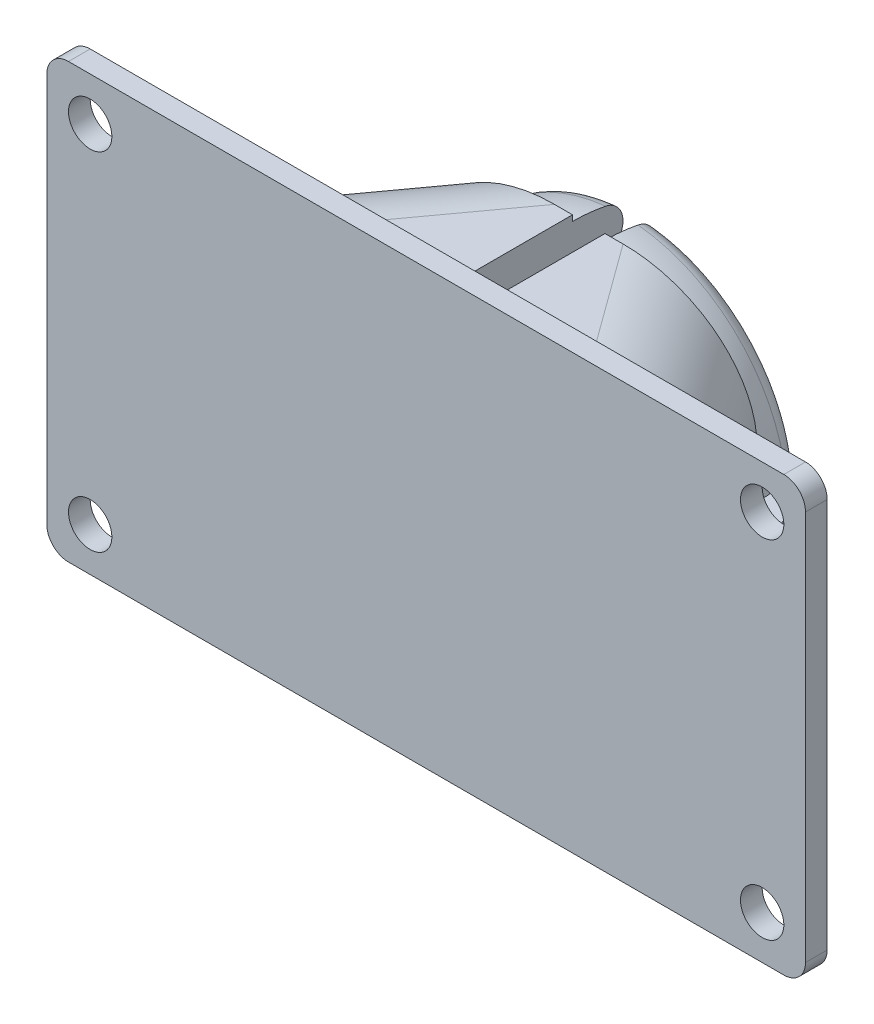
from build123d import *

# Parameters (mm, degrees)
ESQUISSE1_W                     = 70
ESQUISSE1_H                     = 40
BOSS_EXTRU_1_DEPTH              = 2
BOSS_EXTRU_2_DEPTH              = 16
CONG_1_R                        = 10
ENL_V_MAT_EXTRU_1_REACH         = 56.046
ESQUISSE5_W                     = 3
ESQUISSE5_H                     = 17
ESQUISSE8_W                     = 17
ESQUISSE8_H                     = 3
ENL_V_MAT_EXTRU_2_DEPTH         = 25
CONG_2_R                        = 2
CONG_3_R                        = 2
ENL_V_MAT_EXTRU_3_REACH         = 46.01
ESQUISSE9_R                     = 2
R_P_TITION_LIN_AIRE1_COUNT      = 2
R_P_TITION_LIN_AIRE1_PITCH      = 62
R_P_TITION_LIN_AIRE1_COUNT_DIR2 = 2
R_P_TITION_LIN_AIRE1_PITCH_DIR2 = 32


# Read off the part's stored shape, not the designer's step: Enlèvement de matière-Révolution1
with BuildPart() as part:
    # Esquisse1 → Boss.-Extru.1 (new body)
    with BuildSketch(Plane.XY):
        Rectangle(ESQUISSE1_W, ESQUISSE1_H)
    extrude(amount=BOSS_EXTRU_1_DEPTH)

    # Esquisse2 → Boss.-Extru.2 (add, symmetric)
    with BuildSketch(Plane(origin=(0, 0, 0), x_dir=(1, 0, 0), z_dir=(0, 1, 0))):
        Polygon((-25, 0), (-15.536948423, 13), (15.536948423, 13), (25, 0), align=None)
    extrude(amount=BOSS_EXTRU_2_DEPTH, both=True)

    # Esquisse3 → Révolution3 (revolve)
    with BuildSketch(Plane(origin=(0, 0, 0), x_dir=(1, 0, 0), z_dir=(0, 1, 0)), mode=Mode.PRIVATE) as r_volution3_sk:
        with BuildLine():
            Line((-13.870716143, 20), (-10.714049926, 15.491813434))
            ThreePointArc((-10.714049926, 15.491813434), (-10.928278666, 14.254083494), (-11, 13))
            Line((-11, 13), (-15.536948423, 13))
            ThreePointArc((-15.536948423, 13), (-15.114651296, 16.597788557), (-13.870716143, 20))
        make_face()
        with BuildLine():
            Line((10.714049926, 15.491813434), (13.870716143, 20))
            ThreePointArc((13.870716143, 20), (15.114651296, 16.597788557), (15.536948423, 13))
            Line((15.536948423, 13), (11, 13))
            ThreePointArc((11, 13), (10.928278666, 14.254083494), (10.714049926, 15.491813434))
        make_face()
    revolve(r_volution3_sk.sketch.rotate(Axis((0, 0, -13), (0, 0, -1)), 180), axis=Axis((0, 0, -13), (0, 0, -1)))

    # Enlèvement de matière-Révolution1 outlin → Enlèvement de matière-Révolution1 (revolve, cut)
    with BuildSketch(Plane.XZ):
        with BuildLine():
            ThreePointArc((11, -13), (7.778174593, -5.221825407), (0, -2))
            Line((0, -2), (0, -13))
            Line((0, -13), (11, -13))
        make_face()
    revolve(axis=Axis((0, 0, 0), (0, 0, 1)), mode=Mode.SUBTRACT)

    # Congé1
    cong_1_edges = [part.edges().sort_by_distance(p)[0] for p in [
        (20.268474212, -16, -6.5),
        (-20.268474212, -16, -6.5),
        (20.268474212, 16, -6.5),
        (-20.268474212, 16, -6.5),
    ]]
    fillet(cong_1_edges, radius=CONG_1_R)

    # Enlèv. mat.-Extru.1: up to this face of the body (flat: up to its plane)
    enl_v_mat_extru_1_end = Plane(part.part.faces().sort_by_distance((0, 16, -5.202266883))[0])
    # Esquisse5 → Enlèv. mat.-Extru.1 (cut, up to the picked face)
    with BuildSketch(Plane.XZ.offset(16), mode=Mode.PRIVATE) as enl_v_mat_extru_1_sk1:
        with Locations((0, -11.5)):
            Rectangle(ESQUISSE5_W, ESQUISSE5_H)
    enl_v_mat_extru_1_tool1 = split(extrude(enl_v_mat_extru_1_sk1.sketch, amount=-ENL_V_MAT_EXTRU_1_REACH, mode=Mode.PRIVATE), bisect_by=enl_v_mat_extru_1_end, keep=Keep.BOTH, mode=Mode.PRIVATE)
    add(enl_v_mat_extru_1_tool1.solids().sort_by(Axis((0, -16, -11.5), (0, 1, 0)))[0], mode=Mode.SUBTRACT)

    # Esquisse8 → Enlèv. mat.-Extru.2 (cut, symmetric)
    with BuildSketch(Plane(origin=(0, 0, 0), x_dir=(0, 0, -1), z_dir=(1, 0, 0))):
        with Locations((11.5, 0)):
            Rectangle(ESQUISSE8_W, ESQUISSE8_H)
    extrude(amount=ENL_V_MAT_EXTRU_2_DEPTH, both=True, mode=Mode.SUBTRACT)

    # Congé2
    cong_2_edges = [part.edges().sort_by_distance(p)[0] for p in [
        (9.808077444, -9.808077444, -20),
        (9.808077444, 9.808077444, -20),
        (-9.808077444, -9.808077444, -20),
        (-9.808077444, 9.808077444, -20),
    ]]
    fillet(cong_2_edges, radius=CONG_2_R)

    # Congé3
    cong_3_edges = [part.edges().sort_by_distance(p)[0] for p in [
        (35, -20, 1),
        (-35, -20, 1),
        (-35, 20, 1),
        (35, 20, 1),
    ]]
    fillet(cong_3_edges, radius=CONG_3_R)

    # Esquisse9 → Enlèv. mat.-Extru.3 (cut, up to next)
    with BuildSketch(Plane(origin=(0, 0, 0), x_dir=(-1, 0, 0), z_dir=(0, 0, -1)), mode=Mode.PRIVATE) as enl_v_mat_extru_3_sk1:
        with Locations((-31, 16)):
            Circle(ESQUISSE9_R)
    enl_v_mat_extru_3_tool1 = extrude(enl_v_mat_extru_3_sk1.sketch, amount=-ENL_V_MAT_EXTRU_3_REACH, mode=Mode.PRIVATE) & part.part
    enl_v_mat_extru_3 = enl_v_mat_extru_3_tool1.solids().sort_by_distance((31, 16, 0))[0]
    add(enl_v_mat_extru_3, mode=Mode.SUBTRACT)

    # Répétition linéaire1: Enl_v. mat.-Extru.3 2 × 2
    with Locations(*[(-i * R_P_TITION_LIN_AIRE1_PITCH, -j * R_P_TITION_LIN_AIRE1_PITCH_DIR2, 0) for i in range(R_P_TITION_LIN_AIRE1_COUNT) for j in range(R_P_TITION_LIN_AIRE1_COUNT_DIR2) if (i, j) != (0, 0)]):
        add(enl_v_mat_extru_3, mode=Mode.SUBTRACT)


solid = part.part
